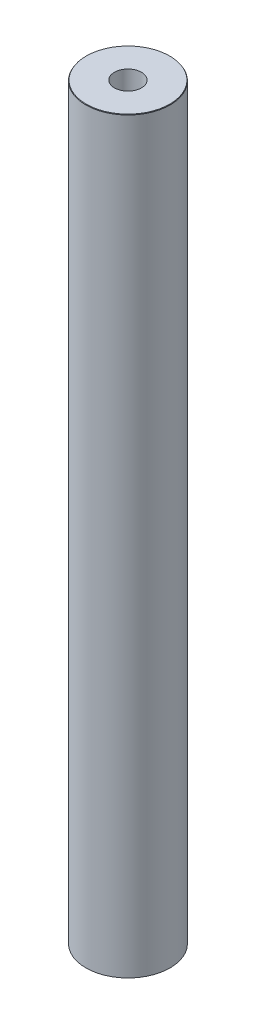
from build123d import *
from OCP.BRepFilletAPI import BRepFilletAPI_MakeChamfer

# Parameters (mm, degrees)
SKETCH1_R           = 32.5
BOSS_EXTRUDE1_DEPTH = 578.117468252
SKETCH2_R           = 10.468981588
CUT_EXTRUDE1_DEPTH  = 580.941641114
CHAMFER1_SIZE       = 0.445353117
CHAMFER1_SIZE2      = 0.257124742


with BuildPart() as part:
    # Sketch1 → Boss-Extrude1 (new body)
    with BuildSketch(Plane(origin=(0, 0, 0), x_dir=(1, 0, 0), z_dir=(0, 1, 0))):
        Circle(SKETCH1_R)
    extrude(amount=BOSS_EXTRUDE1_DEPTH)

    # Sketch2 → Cut-Extrude1 (cut, through all)
    with BuildSketch(Plane(origin=(0, 0, 0), x_dir=(1, 0, 0), z_dir=(0, 1, 0))):
        Circle(SKETCH2_R)
    extrude(amount=CUT_EXTRUDE1_DEPTH, mode=Mode.SUBTRACT)

    # Chamfer1: one chamfer whose edges measure the first distance from different faces: ONE call of the kernel's chamfer builder (chamfer() names one face for all edges)
    chamfer1_edges_1 = [part.edges().sort_by_distance(p)[0] for p in [
        (-32.5, 578.117468252, 0),
    ]]
    chamfer1_side_1 = [part.faces().sort_by_distance(p)[0] for p in [
        (-32.5, 289.058734126, 0),
    ]]
    chamfer1_edges_2 = [part.edges().sort_by_distance(p)[0] for p in [
        (-32.5, 0, 0),
    ]]
    chamfer1_side_2 = [part.faces().sort_by_distance(p)[0] for p in [
        (-31.580761184, 0, 0),
    ]]
    chamfer1 = BRepFilletAPI_MakeChamfer(part.part.solid().wrapped)
    for e in chamfer1_edges_1:
        chamfer1.Add(CHAMFER1_SIZE, CHAMFER1_SIZE2, e.wrapped, chamfer1_side_1[0].wrapped)  # the first distance lies on this face
    for e in chamfer1_edges_2:
        chamfer1.Add(CHAMFER1_SIZE, CHAMFER1_SIZE2, e.wrapped, chamfer1_side_2[0].wrapped)  # the first distance lies on this face
    add(Compound.cast(chamfer1.Shape()), mode=Mode.REPLACE)


solid = part.part
